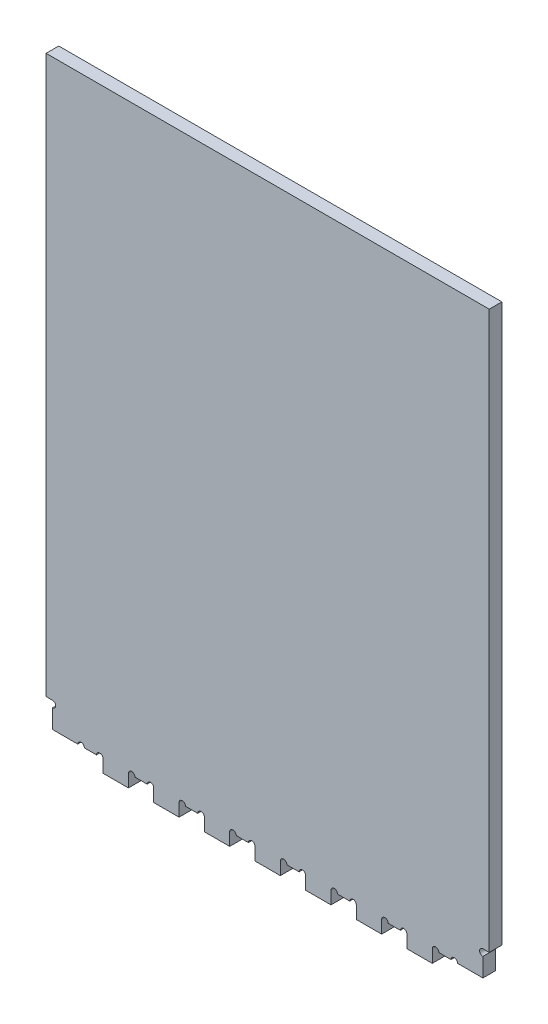
from build123d import *

# Parameters (mm, degrees)
SKETCH1_W            = 444.5
SKETCH1_H            = 609.6
BOSS_EXTRUDE1_DEPTH  = 12.7
CUT_EXTRUDE1_DEPTH   = 378.437931984
LPATTERN1_COUNT      = 8
LPATTERN1_PITCH      = 50.8
MIRROR2_COPY_1_DEPTH = 378.437931984
MIRROR2_COPY_2_DEPTH = 378.437931984
MIRROR2_COPY_3_DEPTH = 378.437931984
MIRROR2_COPY_4_DEPTH = 378.437931984
MIRROR2_COPY_5_DEPTH = 378.437931984
MIRROR2_COPY_6_DEPTH = 378.437931984
MIRROR2_COPY_7_DEPTH = 378.437931984
MIRROR2_COPY_8_DEPTH = 378.437931984
CUT_EXTRUDE2_DEPTH   = 378.437931984
SKETCH4_W            = 444.5
SKETCH4_H            = 12.7
CUT_EXTRUDE3_DEPTH   = 378.437931984
SKETCH5_W            = 444.5
SKETCH5_H            = 18.431928634
BOSS_EXTRUDE2_DEPTH  = 12.7
SKETCH6_W            = 64.693673231
SKETCH6_H            = 12.7
CUT_EXTRUDE4_DEPTH   = 378.437931984


with BuildPart() as part:
    # Sketch1 → Boss-Extrude1 (new body)
    with BuildSketch(Plane.XY):
        Rectangle(SKETCH1_W, SKETCH1_H)
    extrude(amount=BOSS_EXTRUDE1_DEPTH)

    # Sketch2 → Cut-Extrude1 (cut, through all)
    with BuildSketch(Plane.XY.offset(12.7)):
        with BuildLine():
            Line((-165.1, 304.8), (-190.5, 304.8))
            Line((-190.5, 304.8), (-190.5, 292.1))
            ThreePointArc((-190.5, 292.1), (-187.198, 288.798), (-183.896, 292.1))
            Line((-183.896, 292.1), (-171.704, 292.1))
            ThreePointArc((-171.704, 292.1), (-168.402, 288.798), (-165.1, 292.1))
            Line((-165.1, 292.1), (-165.1, 304.8))
        make_face()
    cut_extrude1 = extrude(amount=-CUT_EXTRUDE1_DEPTH, mode=Mode.SUBTRACT)

    # LPattern1: Cut-Extrude1 ×8
    with Locations(*[(i * LPATTERN1_PITCH, 0, 0) for i in range(1, LPATTERN1_COUNT)]):
        add(cut_extrude1, mode=Mode.SUBTRACT)

    # Mirror2 copy 1 sketch → Mirror2 copy 1 (cut, through all)
    with BuildSketch(Plane(origin=(50.8, 0, 12.7), x_dir=(1, 0, 0), z_dir=(0, 0, 1))):
        with BuildLine():
            Line((-165.1, -304.8), (-190.5, -304.8))
            Line((-190.5, -304.8), (-190.5, -292.1))
            ThreePointArc((-190.5, -292.1), (-187.198, -288.798), (-183.896, -292.1))
            Line((-183.896, -292.1), (-171.704, -292.1))
            ThreePointArc((-171.704, -292.1), (-168.402, -288.798), (-165.1, -292.1))
            Line((-165.1, -292.1), (-165.1, -304.8))
        make_face()
    extrude(amount=-MIRROR2_COPY_1_DEPTH, mode=Mode.SUBTRACT)

    # Mirror2 copy 2 sketch → Mirror2 copy 2 (cut, through all)
    with BuildSketch(Plane(origin=(101.6, 0, 12.7), x_dir=(1, 0, 0), z_dir=(0, 0, 1))):
        with BuildLine():
            Line((-165.1, -304.8), (-190.5, -304.8))
            Line((-190.5, -304.8), (-190.5, -292.1))
            ThreePointArc((-190.5, -292.1), (-187.198, -288.798), (-183.896, -292.1))
            Line((-183.896, -292.1), (-171.704, -292.1))
            ThreePointArc((-171.704, -292.1), (-168.402, -288.798), (-165.1, -292.1))
            Line((-165.1, -292.1), (-165.1, -304.8))
        make_face()
    extrude(amount=-MIRROR2_COPY_2_DEPTH, mode=Mode.SUBTRACT)

    # Mirror2 copy 3 sketch → Mirror2 copy 3 (cut, through all)
    with BuildSketch(Plane(origin=(152.4, 0, 12.7), x_dir=(1, 0, 0), z_dir=(0, 0, 1))):
        with BuildLine():
            Line((-165.1, -304.8), (-190.5, -304.8))
            Line((-190.5, -304.8), (-190.5, -292.1))
            ThreePointArc((-190.5, -292.1), (-187.198, -288.798), (-183.896, -292.1))
            Line((-183.896, -292.1), (-171.704, -292.1))
            ThreePointArc((-171.704, -292.1), (-168.402, -288.798), (-165.1, -292.1))
            Line((-165.1, -292.1), (-165.1, -304.8))
        make_face()
    extrude(amount=-MIRROR2_COPY_3_DEPTH, mode=Mode.SUBTRACT)

    # Mirror2 copy 4 sketch → Mirror2 copy 4 (cut, through all)
    with BuildSketch(Plane(origin=(203.2, 0, 12.7), x_dir=(1, 0, 0), z_dir=(0, 0, 1))):
        with BuildLine():
            Line((-165.1, -304.8), (-190.5, -304.8))
            Line((-190.5, -304.8), (-190.5, -292.1))
            ThreePointArc((-190.5, -292.1), (-187.198, -288.798), (-183.896, -292.1))
            Line((-183.896, -292.1), (-171.704, -292.1))
            ThreePointArc((-171.704, -292.1), (-168.402, -288.798), (-165.1, -292.1))
            Line((-165.1, -292.1), (-165.1, -304.8))
        make_face()
    extrude(amount=-MIRROR2_COPY_4_DEPTH, mode=Mode.SUBTRACT)

    # Mirror2 copy 5 sketch → Mirror2 copy 5 (cut, through all)
    with BuildSketch(Plane(origin=(254, 0, 12.7), x_dir=(1, 0, 0), z_dir=(0, 0, 1))):
        with BuildLine():
            Line((-165.1, -304.8), (-190.5, -304.8))
            Line((-190.5, -304.8), (-190.5, -292.1))
            ThreePointArc((-190.5, -292.1), (-187.198, -288.798), (-183.896, -292.1))
            Line((-183.896, -292.1), (-171.704, -292.1))
            ThreePointArc((-171.704, -292.1), (-168.402, -288.798), (-165.1, -292.1))
            Line((-165.1, -292.1), (-165.1, -304.8))
        make_face()
    extrude(amount=-MIRROR2_COPY_5_DEPTH, mode=Mode.SUBTRACT)

    # Mirror2 copy 6 sketch → Mirror2 copy 6 (cut, through all)
    with BuildSketch(Plane(origin=(304.8, 0, 12.7), x_dir=(1, 0, 0), z_dir=(0, 0, 1))):
        with BuildLine():
            Line((-165.1, -304.8), (-190.5, -304.8))
            Line((-190.5, -304.8), (-190.5, -292.1))
            ThreePointArc((-190.5, -292.1), (-187.198, -288.798), (-183.896, -292.1))
            Line((-183.896, -292.1), (-171.704, -292.1))
            ThreePointArc((-171.704, -292.1), (-168.402, -288.798), (-165.1, -292.1))
            Line((-165.1, -292.1), (-165.1, -304.8))
        make_face()
    extrude(amount=-MIRROR2_COPY_6_DEPTH, mode=Mode.SUBTRACT)

    # Mirror2 copy 7 sketch → Mirror2 copy 7 (cut, through all)
    with BuildSketch(Plane(origin=(355.6, 0, 12.7), x_dir=(1, 0, 0), z_dir=(0, 0, 1))):
        with BuildLine():
            Line((-165.1, -304.8), (-190.5, -304.8))
            Line((-190.5, -304.8), (-190.5, -292.1))
            ThreePointArc((-190.5, -292.1), (-187.198, -288.798), (-183.896, -292.1))
            Line((-183.896, -292.1), (-171.704, -292.1))
            ThreePointArc((-171.704, -292.1), (-168.402, -288.798), (-165.1, -292.1))
            Line((-165.1, -292.1), (-165.1, -304.8))
        make_face()
    extrude(amount=-MIRROR2_COPY_7_DEPTH, mode=Mode.SUBTRACT)

    # Mirror2 copy 8 sketch → Mirror2 copy 8 (cut, through all)
    with BuildSketch(Plane.XY.offset(12.7)):
        with BuildLine():
            Line((-165.1, -304.8), (-190.5, -304.8))
            Line((-190.5, -304.8), (-190.5, -292.1))
            ThreePointArc((-190.5, -292.1), (-187.198, -288.798), (-183.896, -292.1))
            Line((-183.896, -292.1), (-171.704, -292.1))
            ThreePointArc((-171.704, -292.1), (-168.402, -288.798), (-165.1, -292.1))
            Line((-165.1, -292.1), (-165.1, -304.8))
        make_face()
    extrude(amount=-MIRROR2_COPY_8_DEPTH, mode=Mode.SUBTRACT)

    # Sketch3 → Cut-Extrude2 (cut, through all)
    with BuildSketch(Plane.XY.offset(12.7)):
        with BuildLine():
            Line((-222.25, -266.7), (-222.25, -304.8))
            Line((-222.25, -304.8), (-215.9, -304.8))
            Line((-215.9, -304.8), (-215.9, -273.304))
            ThreePointArc((-215.9, -273.304), (-212.598, -270.002), (-215.9, -266.7))
            Line((-215.9, -266.7), (-222.25, -266.7))
        make_face()
    cut_extrude2 = extrude(amount=-CUT_EXTRUDE2_DEPTH, mode=Mode.SUBTRACT)

    # Mirror3: Cut-Extrude2 across plane
    add(cut_extrude2.mirror(Plane(origin=(0, 0, 0), x_dir=(0, 0, 1), z_dir=(1, 0, 0))), mode=Mode.SUBTRACT)

    # Sketch4 → Cut-Extrude3 (cut, through all)
    with BuildSketch(Plane.XY.offset(12.7)):
        with Locations((0, 298.45)):
            Rectangle(SKETCH4_W, SKETCH4_H)
    extrude(amount=-CUT_EXTRUDE3_DEPTH, mode=Mode.SUBTRACT)

    # Sketch5 → Boss-Extrude2 (add)
    with BuildSketch(Plane.XY.offset(12.7)):
        with Locations((0, 282.884035683)):
            Rectangle(SKETCH5_W, SKETCH5_H)
    extrude(amount=-BOSS_EXTRUDE2_DEPTH)

    # Sketch6 → Cut-Extrude4 (cut, through all)
    with BuildSketch(Plane.XY.offset(12.7)):
        with Locations((-197.446836616, -298.45)):
            Rectangle(SKETCH6_W, SKETCH6_H)
    cut_extrude4 = extrude(amount=-CUT_EXTRUDE4_DEPTH, mode=Mode.SUBTRACT)

    # Mirror4: Cut-Extrude4 across plane
    add(cut_extrude4.mirror(Plane(origin=(0, 0, 0), x_dir=(0, 0, 1), z_dir=(1, 0, 0))), mode=Mode.SUBTRACT)


solid = part.part
